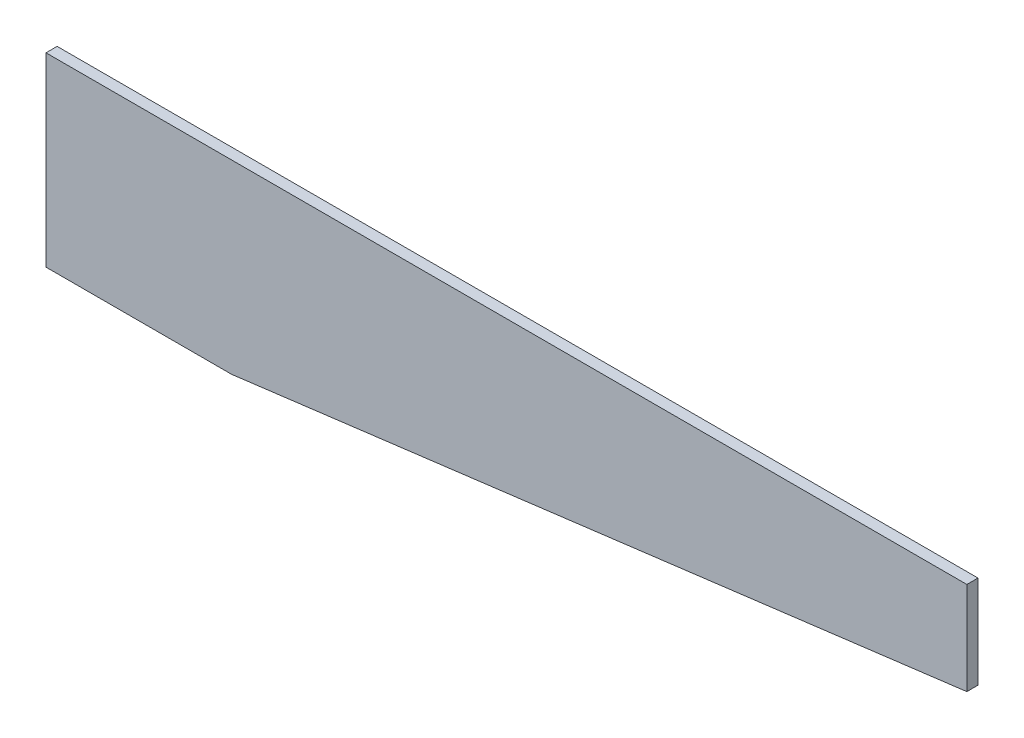
from build123d import *

# Parameters (mm, degrees)
SM_BASE_FLANGE_1_DEPTH = 6


# Sheet-metal steps are written as plain solids
with BuildPart() as part:
    # Sketch 1 → 基体-法兰1 (new body)
    with BuildSketch(Plane.XY):
        Polygon((0, 0), (0, 100), (496, 100), (496, 50), (100, 0), align=None)
    extrude(amount=-SM_BASE_FLANGE_1_DEPTH)


solid = part.part
